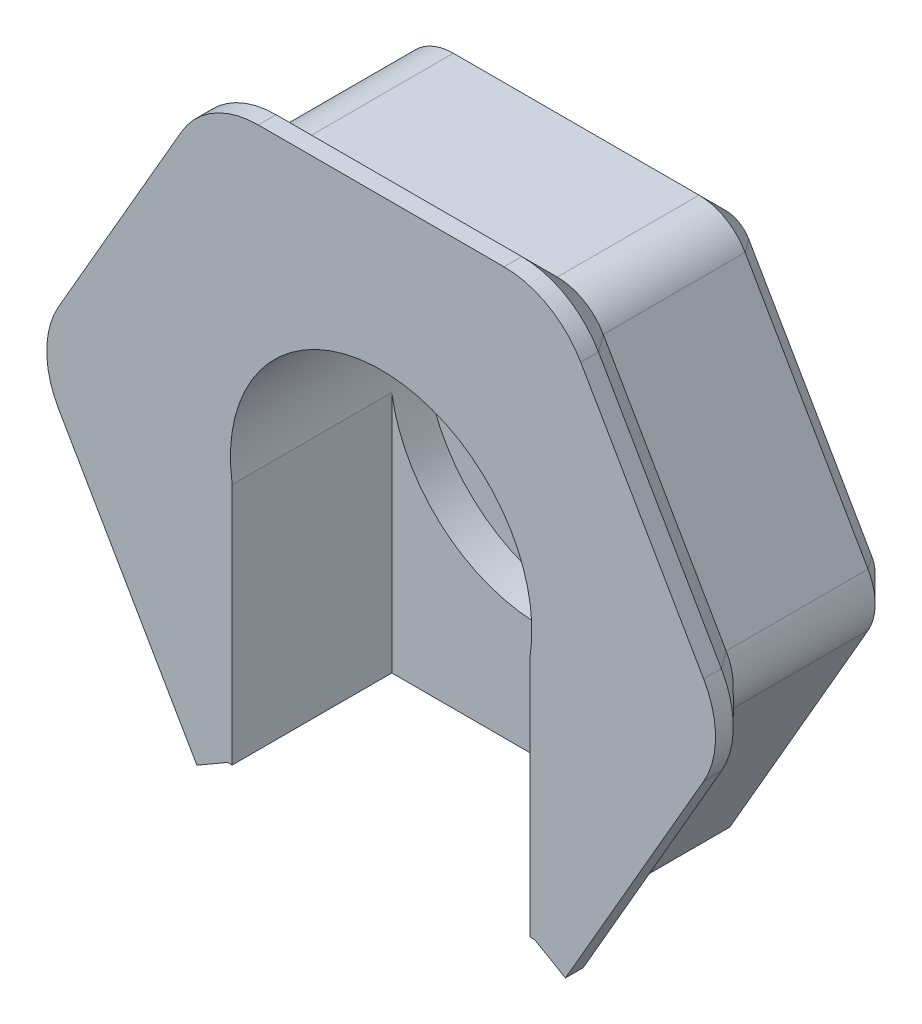
from build123d import *

# Parameters (mm, degrees)
SKETCH1_R           = 8.5
BOSS_EXTRUDE1_DEPTH = 1.5
SKETCH1_4_R         = 15
SKETCH1_4_R_2       = 8.5
BOSS_EXTRUDE2_DEPTH = 12.5
CUT_EXTRUDE1_START  = 2
SKETCH2_W           = 16.8
SKETCH2_H           = 15
CUT_EXTRUDE1_DEPTH  = 24.416530054
FILLET1_R           = 3
SKETCH3_R           = 3.15
CUT_EXTRUDE2_DEPTH  = 26.102558411
FILLET3_SIZE        = 1.5
BOSS_EXTRUDE3_DEPTH = 1
CHAMFER1_SIZE       = 2


with BuildPart() as part:
    # Sketch1 → Boss-Extrude1 (new body)
    with BuildSketch(Plane.XY):
        Circle(SKETCH1_R)
    extrude(amount=BOSS_EXTRUDE1_DEPTH)

    # Sketch1<4> → Boss-Extrude2 (add)
    # profile 1 of 7: a face of its own
    with BuildSketch(Plane.XY):
        Circle(SKETCH1_4_R)
        with Locations(Location((0, 0, 0), (0, 0, 180))):
            Circle(SKETCH1_4_R_2, mode=Mode.SUBTRACT)
    # profile 2 of 7: a face of its own
    with BuildSketch(Plane.XY):
        with BuildLine():
            Line((12.990381063, 7.499999988), (8.660254038, 15))
            Line((8.660254038, 15), (-1.6e-08, 15))
            ThreePointArc((-1.6e-08, 15), (7.499999999, 12.990381058), (12.990381063, 7.499999988))
        make_face()
    # profile 3 of 7: a face of its own
    with BuildSketch(Plane.XY):
        with BuildLine():
            ThreePointArc((-12.99038099, 7.500000116), (-7.499999949, 12.990381086), (-1.6e-08, 15))
            Line((-1.6e-08, 15), (-8.660254038, 15))
            Line((-8.660254038, 15), (-12.99038099, 7.500000116))
        make_face()
    # profile 4 of 7: a face of its own
    with BuildSketch(Plane.XY):
        with BuildLine():
            ThreePointArc((-12.990380876, -7.500000313), (-15, -1.14e-07), (-12.99038099, 7.500000116))
            Line((-12.99038099, 7.500000116), (-17.320508076, 0))
            Line((-17.320508076, 0), (-12.990380876, -7.500000313))
        make_face()
    # profile 5 of 7: a face of its own
    with BuildSketch(Plane.XY):
        with BuildLine():
            Line((17.320508076, 0), (12.990381063, 7.499999988))
            ThreePointArc((12.990381063, 7.499999988), (14.488887396, 3.88228567), (15, 0))
            ThreePointArc((15, 0), (14.488887391, -3.88228569), (12.990381043, -7.500000024))
            Line((12.990381043, -7.500000024), (17.320508076, 0))
        make_face()
    # profile 6 of 7: a face of its own
    with BuildSketch(Plane.XY):
        with BuildLine():
            Line((8.660254038, -15), (12.990381043, -7.500000024))
            ThreePointArc((12.990381043, -7.500000024), (7.499999988, -12.990381064), (0, -15))
            Line((0, -15), (8.660254038, -15))
        make_face()
    # profile 7 of 7: a face of its own
    with BuildSketch(Plane.XY):
        with BuildLine():
            ThreePointArc((0, -15), (-7.499999843, -12.990381147), (-12.990380876, -7.500000313))
            Line((-12.990380876, -7.500000313), (-8.660254038, -15))
            Line((-8.660254038, -15), (0, -15))
        make_face()
    extrude(amount=BOSS_EXTRUDE2_DEPTH)

    # Sketch2 → Cut-Extrude1 (cut, through all)
    with BuildSketch(Plane.XY.offset(1.5).offset(CUT_EXTRUDE1_START)):
        with Locations((0, -7.5)):
            Rectangle(SKETCH2_W, SKETCH2_H)
    extrude(amount=CUT_EXTRUDE1_DEPTH, mode=Mode.SUBTRACT)

    # Fillet1
    fillet1_edges = [part.edges().sort_by_distance(p)[0] for p in [
        (17.320508076, 0, 6.25),
        (8.660254038, 15, 6.25),
        (-8.660254038, 15, 6.25),
        (-17.320508076, 0, 6.25),
    ]]
    fillet(fillet1_edges, radius=FILLET1_R)

    # Sketch3 → Cut-Extrude2 (cut, through all)
    with BuildSketch(Plane.XY.offset(1.5)):
        Circle(SKETCH3_R)
    extrude(amount=-CUT_EXTRUDE2_DEPTH, mode=Mode.SUBTRACT)

    # Fillet3
    fillet3_edges = [part.edges().sort_by_distance(p)[0] for p in [
        (-12.557368355, -8.25, 0),
        (12.990381057, 7.5, 0),
        (-12.990381057, 7.5, 0),
        (0, 15, 0),
        (16.856406461, 0, 0),
        (8.42820323, 14.598076211, 0),
        (-8.42820323, 14.598076211, 0),
        (-16.856406461, 0, 0),
        (0, -15, 0),
        (12.557368355, -8.25, 0),
    ]]
    chamfer(fillet3_edges, length=FILLET3_SIZE)

    # Sketch5 → Boss-Extrude3 (add)
    with BuildSketch(Plane.XY.offset(12.5)):
        with BuildLine():
            Line((-10.392304845, -16), (-8.660254038, -15))
            Line((-8.660254038, -15), (-16.454482672, -1.5))
            ThreePointArc((-16.454482672, -1.5), (-16.856406461, 0), (-16.454482672, 1.5))
            Line((-16.454482672, 1.5), (-9.526279442, 13.5))
            ThreePointArc((-9.526279442, 13.5), (-8.42820323, 14.598076211), (-6.92820323, 15))
            Line((-6.92820323, 15), (6.92820323, 15))
            ThreePointArc((6.92820323, 15), (8.42820323, 14.598076211), (9.526279442, 13.5))
            Line((9.526279442, 13.5), (16.454482672, 1.5))
            ThreePointArc((16.454482672, 1.5), (16.856406461, 0), (16.454482672, -1.5))
            Line((16.454482672, -1.5), (8.660254038, -15))
            Line((8.660254038, -15), (10.392304845, -16))
            Line((10.392304845, -16), (18.186533479, -2.5))
            ThreePointArc((18.186533479, -2.5), (18.856406461, 0), (18.186533479, 2.5))
            Line((18.186533479, 2.5), (11.258330249, 14.5))
            ThreePointArc((11.258330249, 14.5), (9.42820323, 16.330127019), (6.92820323, 17))
            Line((6.92820323, 17), (-6.92820323, 17))
            ThreePointArc((-6.92820323, 17), (-9.42820323, 16.330127019), (-11.258330249, 14.5))
            Line((-11.258330249, 14.5), (-18.186533479, 2.5))
            ThreePointArc((-18.186533479, 2.5), (-18.856406461, 0), (-18.186533479, -2.5))
            Line((-18.186533479, -2.5), (-10.392304845, -16))
        make_face()
    extrude(amount=-BOSS_EXTRUDE3_DEPTH)

    # Chamfer1
    chamfer1_edges = [part.edges().sort_by_distance(p)[0] for p in [
        (12.557368355, -8.25, 11.5),
        (16.856406461, 0, 11.5),
        (12.990381057, 7.5, 11.5),
        (8.42820323, 14.598076211, 11.5),
        (0, 15, 11.5),
        (-8.42820323, 14.598076211, 11.5),
        (-12.990381057, 7.5, 11.5),
        (-16.856406461, 0, 11.5),
        (-12.557368355, -8.25, 11.5),
    ]]
    chamfer(chamfer1_edges, length=CHAMFER1_SIZE - 0.0001)  # a hair under: the kernel refuses the full size


solid = part.part
